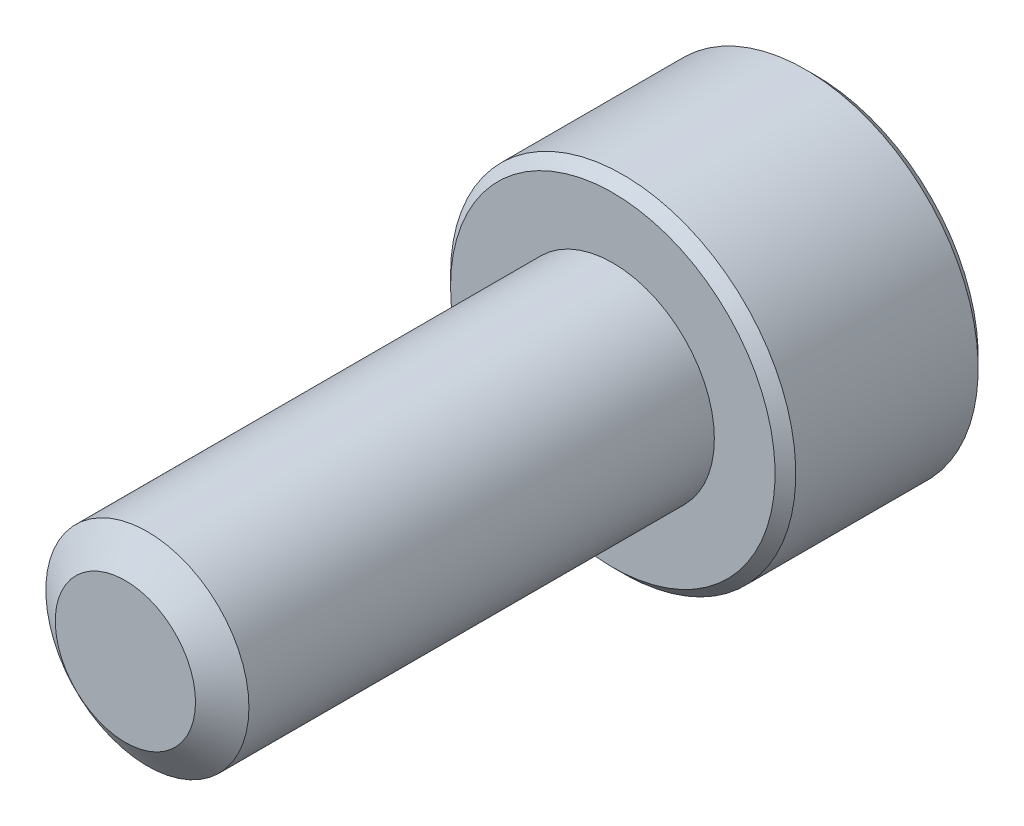
from build123d import *

# Parameters (mm, degrees)
SKETCH1_R          = 2.5
EXTRUDE1_DEPTH     = 12
SKETCH6_R          = 4.25
EXTRUDE2_DEPTH     = 5
CUT_EXTRUDE1_DEPTH = 3
CHAMFER1_SIZE      = 0.255


with BuildPart() as part:
    # Sketch1 → Extrude1 (new body)
    with BuildSketch(Plane.XY):
        Circle(SKETCH1_R)
    extrude(amount=-EXTRUDE1_DEPTH)

    # Sketch4 → Cut-Revolve1 (revolve, cut)
    with BuildSketch(Plane(origin=(0, 0, 0), x_dir=(0, 0, -1), z_dir=(1, 0, 0))):
        Polygon((0.541691224, 2.5), (0, 1.726384758), (0, 2.5), align=None)
    revolve(axis=Axis((0, 0, 0), (0, 0, -1)), mode=Mode.SUBTRACT)

    # Sketch6 → Extrude2 (add)
    with BuildSketch(Plane(origin=(0, 0, -12), x_dir=(-1, 0, 0), z_dir=(0, 0, -1))):
        Circle(SKETCH6_R)
    extrude(amount=EXTRUDE2_DEPTH)

    # Sketch7 → Cut-Extrude1 (cut)
    with BuildSketch(Plane(origin=(0, 0, -17), x_dir=(-1, 0, 0), z_dir=(0, 0, -1))):
        Polygon((0, 2.309401077), (-2, 1.154700538), (-2, -1.154700538), (0, -2.309401077), (2, -1.154700538), (2, 1.154700538), align=None)
    extrude(amount=-CUT_EXTRUDE1_DEPTH, mode=Mode.SUBTRACT)

    # Cut-Extrude2 cone 1 section (through the dimple's axis) → Cut-Extrude2 (revolve, cut)
    with BuildSketch(Plane(origin=(0, 0, -17), x_dir=(0, 1, 0), z_dir=(1, 0, 0))):
        Polygon((0, 0), (2.309401077, 0), (0, 2.309401077), align=None)
    revolve(axis=Axis((0, 0, -17), (0, 0, 1)), mode=Mode.SUBTRACT)

    # Chamfer1
    chamfer1_edges = [part.edges().sort_by_distance(p)[0] for p in [
        (4.25, 0, -17),
        (4.25, 0, -12),
    ]]
    chamfer(chamfer1_edges, length=CHAMFER1_SIZE)

    # Sketch10 → Revolve1 (revolve)
    with BuildSketch(Plane(origin=(0, 0, 0), x_dir=(0, 0, -1), z_dir=(1, 0, 0))):
        Polygon((12, 2.5), (12, 0), (10.764466094, 0), (11.8, 2.5), align=None)
    revolve(axis=Axis((0, 0, -12), (0, 0, 1)))


solid = part.part
